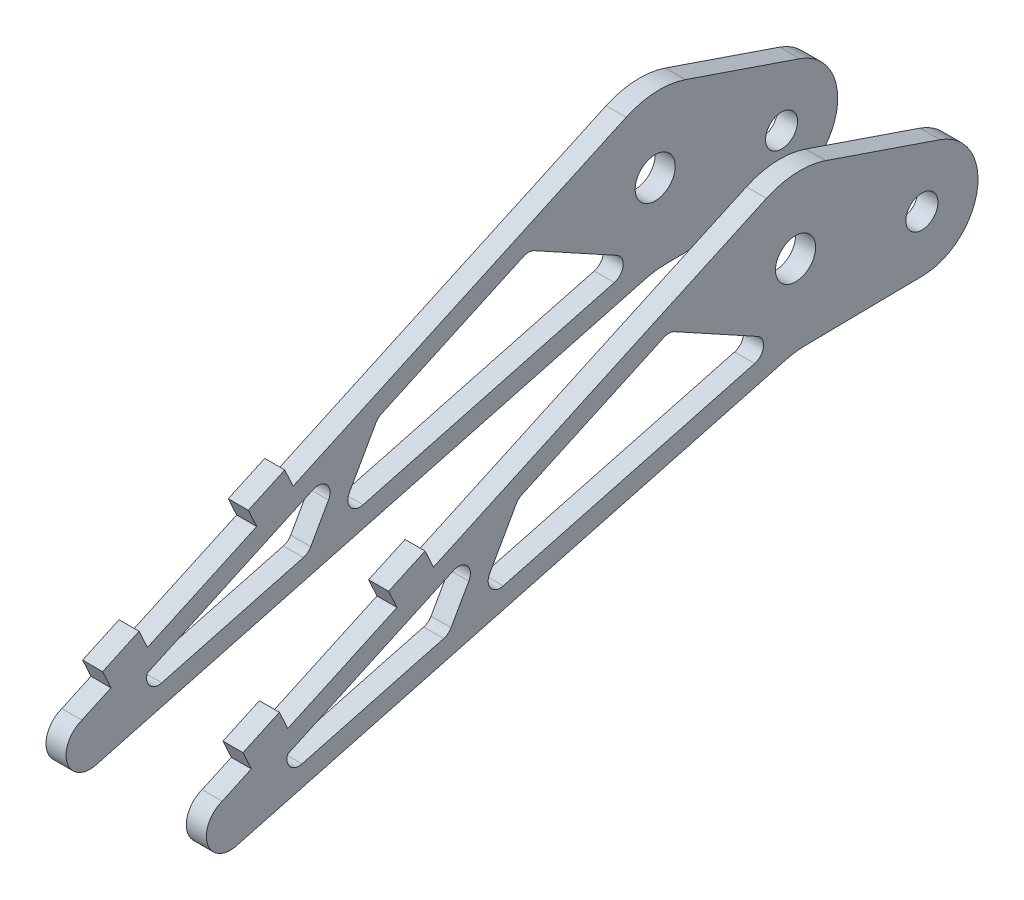
from build123d import *

# Parameters (mm, degrees)
SKETCH1_R           = 4
SKETCH1_R_2         = 5
BOSS_EXTRUDE1_DEPTH = 5
FILLET3_R           = 20
FILLET6_R           = 3


with BuildPart() as part:
    # Sketch1 → Boss-Extrude1 (new body)
    # profile 1 of 3: a face of its own
    with BuildSketch(Plane.YZ):
        with BuildLine():
            Line((-14.443258315, 31.513848096), (-13.998623919, -0.196286448))
            ThreePointArc((-13.998623919, -0.196286448), (-2.196477435, -13.826622396), (13.248647006, -4.52474889))
            Line((13.248647006, -4.52474889), (25.556741685, 31.513848096))
            Line((25.556741685, 31.513848096), (-15.913444308, 121.828294459))
            Line((-15.913444308, 121.828294459), (-17.991906384, 126.354803013))
            Line((-17.991906384, 126.354803013), (-20.086315573, 130.916041451))
            Line((-20.086315573, 130.916041451), (-32.596955812, 158.161917487))
            Line((-32.596955812, 158.161917487), (-34.683391444, 162.705790984))
            Line((-34.683391444, 162.705790984), (-36.769827077, 167.24966448))
            Line((-36.769827077, 167.24966448), (-40.108124089, 174.519862074))
            ThreePointArc((-40.108124089, 174.519862074), (-47.798400673, 178.105896939), (-51.384435538, 170.415620354))
            Line((-51.384435538, 170.415620354), (-14.443258315, 31.513848096))
        make_face()
        with Locations(Location((0, 0, 0), (0, 0, 270))):
            Circle(SKETCH1_R, mode=Mode.SUBTRACT)
        with Locations(Location((5.556741685, 31.513848096, 0), (0, 0, 270))):
            Circle(SKETCH1_R_2, mode=Mode.SUBTRACT)
        Polygon((-10.059219018, 34.483430451), (-30.486505123, 111.291655193), (-11.718080145, 100.709404741), (5.599975549, 62.99386104), align=None, mode=Mode.SUBTRACT)
        Polygon((-38.215011053, 158.414852351), (-15.274502195, 108.454638594), (-32.282363467, 118.044225778), (-44.116299331, 162.540768328), align=None, mode=Mode.SUBTRACT)
    # profile 2 of 3: a face of its own
    with BuildSketch(Plane.YZ):
        Polygon((-17.991906384, 126.354803013), (-15.913444308, 121.828294459), (-11.369603993, 123.914714855), (-15.542475258, 133.002461848), (-20.086315573, 130.916041451), align=None)
    # profile 3 of 3: a face of its own
    with BuildSketch(Plane.YZ):
        Polygon((-32.22595358, 169.336100113), (-36.769827077, 167.24966448), (-34.683391444, 162.705790984), (-32.596955812, 158.161917487), (-28.053082315, 160.24835312), align=None)
    extrude(amount=-BOSS_EXTRUDE1_DEPTH)

    # Fillet3
    fillet3_edges = [part.edges().sort_by_distance(p)[0] for p in [
        (-2.5, 25.556741685, 31.513848096),
        (-2.5, -14.443258315, 31.513848096),
    ]]
    fillet(fillet3_edges, radius=FILLET3_R)

    # Fillet6
    # the kernel refuses this fillet: 3 mm, written as the material it adds along each edge
    with BuildSketch(Plane(origin=(0, -38.215011053, 158.414852351), x_dir=(0, 0.41728712651347166, -0.9087746992770703), z_dir=(-1, 0, 0))) as fillet6_piece_1:
        with BuildLine():
            CenterArc((FILLET6_R * 0.271478941521, FILLET6_R), FILLET6_R, 239.62294962, 30.37705038)
            Line((-FILLET6_R * 0.23420930525, FILLET6_R * 0.137283709973), (0, 0))
            Line((0, 0), (FILLET6_R * 0.271478941521, 0))
        make_face()
    extrude(amount=5)
    with BuildSketch(Plane(origin=(0, -32.282363467, 118.044225778), x_dir=(0, 0.8710790696902164, -0.49114280443433855), z_dir=(-1, 0, 0))) as fillet6_piece_2:
        with BuildLine():
            CenterArc((FILLET6_R * 0.421297147858, -FILLET6_R), FILLET6_R, 90, 45.691106369)
            Line((-FILLET6_R * 0.294287167004, -FILLET6_R * 0.301473630904), (0, 0))
            Line((0, 0), (FILLET6_R * 0.421297147858, 0))
        make_face()
    extrude(amount=5)
    with BuildSketch(Plane(origin=(0, -30.486505123, 111.291655193), x_dir=(0, 0.25701761253564515, -0.9664067191645953), z_dir=(-1, 0, 0))) as fillet6_piece_3:
        with BuildLine():
            CenterArc((FILLET6_R * 2.37362157585, -FILLET6_R), FILLET6_R, 90, 134.308893631)
            Line((FILLET6_R * 1.65803726099, -FILLET6_R * 1.6985263691), (0, 0))
            Line((0, 0), (FILLET6_R * 2.37362157585, 0))
        make_face()
    extrude(amount=5)
    with BuildSketch(Plane(origin=(0, -11.718080145, 100.709404741), x_dir=(0, -0.8710790696902125, 0.4911428044343457), z_dir=(-1, 0, 0))) as fillet6_piece_4:
        with BuildLine():
            CenterArc((FILLET6_R * 0.324156203472, -FILLET6_R), FILLET6_R, 90, 35.920846961)
            Line((-FILLET6_R * 0.262510846562, -FILLET6_R * 0.190171763641), (0, 0))
            Line((0, 0), (FILLET6_R * 0.324156203472, 0))
        make_face()
    extrude(amount=5)
    with BuildSketch(Plane(origin=(0, -10.059219018, 34.483430451), x_dir=(0, -0.2570176125356449, 0.9664067191645953), z_dir=(-1, 0, 0))) as fillet6_piece_5:
        with BuildLine():
            CenterArc((FILLET6_R * 2.49571060233, FILLET6_R), FILLET6_R, 133.670716463, 136.329283537)
            Line((FILLET6_R * 1.80519778573, FILLET6_R * 1.72332015741), (0, 0))
            Line((0, 0), (FILLET6_R * 2.49571060233, 0))
        make_face()
    extrude(amount=5)
    with BuildSketch(Plane(origin=(0, 5.599975549, 62.99386104), x_dir=(0, -0.41728712651347205, 0.9087746992770702), z_dir=(-1, 0, 0))) as fillet6_piece_6:
        with BuildLine():
            CenterArc((FILLET6_R * 0.503395718442, -FILLET6_R), FILLET6_R, 90, 53.440975871)
            Line((-FILLET6_R * 0.299847949894, -FILLET6_R * 0.404349423506), (0, 0))
            Line((0, 0), (FILLET6_R * 0.503395718442, 0))
        make_face()
    extrude(amount=5)
    with BuildSketch(Plane(origin=(0, -15.274502195, 108.454638594), x_dir=(0, -0.4172871265134709, 0.9087746992770708), z_dir=(-1, 0, 0))) as fillet6_piece_7:
        with BuildLine():
            CenterArc((FILLET6_R * 3.08493247789, -FILLET6_R), FILLET6_R, 90, 144.079153039)
            Line((FILLET6_R * 2.49826542786, -FILLET6_R * 1.80982823636), (0, 0))
            Line((0, 0), (FILLET6_R * 3.08493247789, 0))
        make_face()
    extrude(amount=5)
    with BuildSketch(Plane(origin=(0, -44.116299331, 162.540768328), x_dir=(0, 0.2570176125356455, -0.9664067191645951), z_dir=(-1, 0, 0))) as fillet6_piece_8:
        with BuildLine():
            CenterArc((FILLET6_R * 2.73652664972, -FILLET6_R), FILLET6_R, 90, 139.852690212)
            Line((FILLET6_R * 2.09177163516, -FILLET6_R * 1.76438927988), (0, 0))
            Line((0, 0), (FILLET6_R * 2.73652664972, 0))
        make_face()
    extrude(amount=5)


with BuildPart() as body_2:
    # Mirror4: mirrored copy
    add(part.part.mirror(Plane(origin=(15, 0, 0), x_dir=(0, 0, 1), z_dir=(1, 0, 0))))


solid = Compound([part.part, body_2.part])
